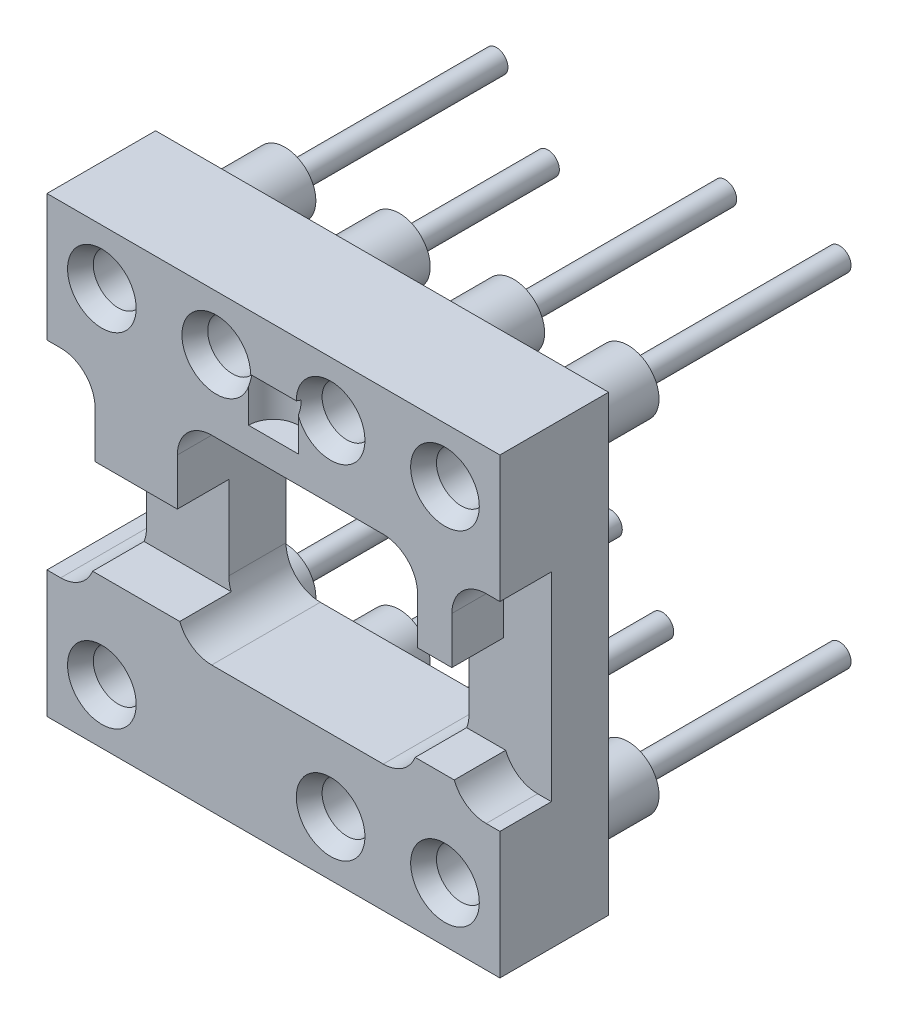
from build123d import *

# Parameters (mm, degrees)
ESQUISSE1_W             = 10.0584
ESQUISSE1_H             = 10.0584
BOSS_EXTRU_1_DEPTH      = 2.413
ESQUISSE2_W             = 5.334
ESQUISSE2_H             = 4.4196
ENL_V_MAT_EXTRU_1_DEPTH = 8.510544207
ESQUISSE3_W             = 1.143
ESQUISSE3_H             = 2.1336
ENL_V_MAT_EXTRU_2_DEPTH = 10.941918215
ESQUISSE4_W             = 1.0668
ESQUISSE4_H             = 1.8034
ENL_V_MAT_EXTRU_3_DEPTH = 1.143
ENL_V_MAT_EXTRU_4_DEPTH = 1.143
ESQUISSE6_W             = 1.0668
ESQUISSE6_H             = 4.4196
ENL_V_MAT_EXTRU_5_DEPTH = 8.510544207
ESQUISSE7_W             = 1.143
ESQUISSE7_H             = 2.1336
ENL_V_MAT_EXTRU_6_DEPTH = 10.078608125
PER_AGE1_D              = 1.1049
PER_AGE1_DEPTH          = 0.999998
PER_AGE2_D              = 1.1049
PER_AGE2_DEPTH          = 0.999998
PER_AGE3_D              = 1.1049
PER_AGE3_DEPTH          = 0.999998
ESQUISSE22_W            = 0.55245
ESQUISSE22_H            = 0.999998
PER_AGE5_D              = 1.1049
PER_AGE5_DEPTH          = 0.999998
PER_AGE6_D              = 1.1049
PER_AGE6_DEPTH          = 0.999998
PER_AGE7_D              = 1.1049
PER_AGE7_DEPTH          = 0.999998
PER_AGE8_D              = 1.1049
PER_AGE8_DEPTH          = 0.999998
CHANFREIN1_SIZE         = 0.20955
CHANFREIN1_SIZE2        = 0.362951247
CHANFREIN2_SIZE         = 0.20955
CHANFREIN2_SIZE2        = 0.362951247
CHANFREIN3_SIZE         = 0.20955
CHANFREIN3_SIZE2        = 0.362951247
CHANFREIN4_SIZE         = 0.20955
CHANFREIN4_SIZE2        = 0.362951247
CHANFREIN5_SIZE         = 0.20955
CHANFREIN5_SIZE_2       = 0.362951247
CHANFREIN6_SIZE         = 0.20955
CHANFREIN6_SIZE2        = 0.362951247
CHANFREIN7_SIZE         = 0.20955
CHANFREIN7_SIZE_2       = 0.362951247
CONG_1_R                = 0.762
CONG_2_R                = 0.762
CONG_3_R                = 0.762
CONG_4_R                = 0.762
CONG_5_R                = 0.762
CONG_6_R                = 0.762
CONG_7_R                = 0.762


with BuildPart() as part:
    # Esquisse1 → Boss.-Extru.1 (new body)
    with BuildSketch(Plane.XY):
        Rectangle(ESQUISSE1_W, ESQUISSE1_H)
    extrude(amount=-BOSS_EXTRU_1_DEPTH)

    # Esquisse2 → Enlèv. mat.-Extru.1 (cut, through all)
    with BuildSketch(Plane(origin=(0, 0, -2.413), x_dir=(-1, 0, 0), z_dir=(0, 0, -1))):
        with Locations((-0.5334, 0)):
            Rectangle(ESQUISSE2_W, ESQUISSE2_H)
    extrude(amount=-ENL_V_MAT_EXTRU_1_DEPTH, mode=Mode.SUBTRACT)

    # Esquisse3 → Enlèv. mat.-Extru.2 (cut, through all)
    with BuildSketch(Plane.ZY.offset(-3.2004)):
        with Locations((-0.5715, -0.6604)):
            Rectangle(ESQUISSE3_W, ESQUISSE3_H)
    extrude(amount=-ENL_V_MAT_EXTRU_2_DEPTH, mode=Mode.SUBTRACT)

    # Esquisse4 → Enlèv. mat.-Extru.3 (cut)
    with BuildSketch(Plane.XY):
        with Locations((4.4958, 1.3081)):
            Rectangle(ESQUISSE4_W, ESQUISSE4_H)
    extrude(amount=-ENL_V_MAT_EXTRU_3_DEPTH, mode=Mode.SUBTRACT)

    # Esquisse5 → Enlèv. mat.-Extru.4 (cut)
    with BuildSketch(Plane.XY):
        with BuildLine():
            Line((5.0292, -1.7272), (4.015471485, -1.7272))
            ThreePointArc((4.015471485, -1.7272), (4.295598647, -2.077699516), (4.7244, -2.2098))
            Line((4.7244, -2.2098), (5.0292, -2.2098))
            Line((5.0292, -2.2098), (5.0292, -1.7272))
        make_face()
    extrude(amount=-ENL_V_MAT_EXTRU_4_DEPTH, mode=Mode.SUBTRACT)

    # Esquisse6 → Enlèv. mat.-Extru.5 (cut, through all)
    with BuildSketch(Plane(origin=(0, 0, -2.413), x_dir=(-1, 0, 0), z_dir=(0, 0, -1))):
        with Locations((4.4958, 0)):
            Rectangle(ESQUISSE6_W, ESQUISSE6_H)
    extrude(amount=-ENL_V_MAT_EXTRU_5_DEPTH, mode=Mode.SUBTRACT)

    # Esquisse7 → Enlèv. mat.-Extru.6 (cut, through all)
    with BuildSketch(Plane(origin=(-2.1336, 0, 0), x_dir=(0, 0, -1), z_dir=(1, 0, 0))):
        with Locations((0.5715, -0.6604)):
            Rectangle(ESQUISSE7_W, ESQUISSE7_H)
    extrude(amount=-ENL_V_MAT_EXTRU_6_DEPTH, mode=Mode.SUBTRACT)

    # Esquisse8 → Révolution1 (revolve)
    with BuildSketch(Plane(origin=(0, -3.81, 0), x_dir=(-1, 0, 0), z_dir=(0, 1, 0))):
        Polygon((-4.064, -8.763), (-3.81, -8.763), (-3.81, -2.413), (-4.49834, -2.413), (-4.49834, -4.064), (-4.064, -4.318), align=None)
    revolve(axis=Axis((3.81, -3.81, -8.763), (0, 0, 1)))

    # Esquisse9 → Révolution2 (revolve)
    with BuildSketch(Plane(origin=(0, -3.81, 0), x_dir=(-1, 0, 0), z_dir=(0, 1, 0))):
        Polygon((-1.524, -7.366), (-1.27, -7.366), (-1.27, -2.413), (-1.95834, -2.413), (-1.95834, -4.064), (-1.524, -4.318), align=None)
    revolve(axis=Axis((1.27, -3.81, -7.366), (0, 0, 1)))

    # Esquisse10 → Révolution3 (revolve)
    with BuildSketch(Plane(origin=(0, -3.81, 0), x_dir=(-1, 0, 0), z_dir=(0, 1, 0))):
        Polygon((1.016, -8.763), (1.27, -8.763), (1.27, -2.413), (0.58166, -2.413), (0.58166, -4.064), (1.016, -4.318), align=None)
    revolve(axis=Axis((-1.27, -3.81, -8.763), (0, 0, 1)))

    # Esquisse11 → Révolution4 (revolve)
    with BuildSketch(Plane(origin=(0, -3.81, 0), x_dir=(-1, 0, 0), z_dir=(0, 1, 0))):
        Polygon((3.556, -8.763), (3.81, -8.763), (3.81, -2.413), (3.12166, -2.413), (3.12166, -4.064), (3.556, -4.318), align=None)
    revolve(axis=Axis((-3.81, -3.81, -8.763), (0, 0, 1)))

    # Esquisse12 → Révolution5 (revolve)
    with BuildSketch(Plane(origin=(0, 3.81, 0), x_dir=(-1, 0, 0), z_dir=(0, 1, 0))):
        Polygon((-4.064, -8.763), (-3.81, -8.763), (-3.81, -2.413), (-4.49834, -2.413), (-4.49834, -4.064), (-4.064, -4.318), align=None)
    revolve(axis=Axis((3.81, 3.81, -8.763), (0, 0, 1)))

    # Esquisse13 → Révolution6 (revolve)
    with BuildSketch(Plane(origin=(0, 3.81, 0), x_dir=(-1, 0, 0), z_dir=(0, 1, 0))):
        Polygon((-1.524, -8.763), (-1.27, -8.763), (-1.27, -2.413), (-1.95834, -2.413), (-1.95834, -4.064), (-1.524, -4.318), align=None)
    revolve(axis=Axis((1.27, 3.81, -8.763), (0, 0, 1)))

    # Esquisse14 → Révolution7 (revolve)
    with BuildSketch(Plane(origin=(0, 3.81, 0), x_dir=(-1, 0, 0), z_dir=(0, 1, 0))):
        Polygon((1.016, -7.366), (1.27, -7.366), (1.27, -2.413), (0.58166, -2.413), (0.58166, -4.064), (1.016, -4.318), align=None)
    revolve(axis=Axis((-1.27, 3.81, -7.366), (0, 0, 1)))

    # Esquisse15 → Révolution8 (revolve)
    with BuildSketch(Plane(origin=(0, 3.81, 0), x_dir=(-1, 0, 0), z_dir=(0, 1, 0))):
        Polygon((3.556, -8.763), (3.81, -8.763), (3.81, -2.413), (3.12166, -2.413), (3.12166, -4.064), (3.556, -4.318), align=None)
    revolve(axis=Axis((-3.81, 3.81, -8.763), (0, 0, 1)))

    # Perçage1
    with Locations(Plane.XY):
        with Locations((3.81, -3.81)):
            Hole(PER_AGE1_D / 2, depth=PER_AGE1_DEPTH)

    # Perçage2
    with Locations(Plane.XY):
        with Locations((-3.81, 3.81)):
            Hole(PER_AGE2_D / 2, depth=PER_AGE2_DEPTH)

    # Perçage3
    with Locations(Plane.XY):
        with Locations((1.27, -3.81)):
            Hole(PER_AGE3_D / 2, depth=PER_AGE3_DEPTH)

    # Esquisse22 → Perçage4 (revolve, cut)
    with BuildSketch(Plane(origin=(0, 3.81, 0), x_dir=(0, 0, 1), z_dir=(1, 0, 0))):
        with Locations((0.276225, 0.499999)):
            Rectangle(ESQUISSE22_W, ESQUISSE22_H)
    revolve(axis=Axis((0, -106.19, 0), (0, 1, 0)), mode=Mode.SUBTRACT)

    # Perçage5
    with Locations(Plane.XY):
        with Locations((-3.81, -3.81)):
            Hole(PER_AGE5_D / 2, depth=PER_AGE5_DEPTH)

    # Perçage6
    with Locations(Plane.XY):
        with Locations((1.27, 3.81)):
            Hole(PER_AGE6_D / 2, depth=PER_AGE6_DEPTH)

    # Perçage7
    with Locations(Plane.XY):
        with Locations((3.81, 3.81)):
            Hole(PER_AGE7_D / 2, depth=PER_AGE7_DEPTH)

    # Perçage8
    with Locations(Plane.XY):
        with Locations((-1.27, 3.81)):
            Hole(PER_AGE8_D / 2, depth=PER_AGE8_DEPTH)

    # Chanfrein1
    chanfrein1_edges = [part.edges().sort_by_distance(p)[0] for p in [
        (4.36245, -3.81, 0),
    ]]
    chanfrein1_side = [part.faces().sort_by_distance(p)[0] for p in [
        (-0.07802689, -3.515242334, 0),
    ]]
    chamfer(chanfrein1_edges, length=CHANFREIN1_SIZE, length2=CHANFREIN1_SIZE2, reference=chanfrein1_side[0])

    # Chanfrein2
    chanfrein2_edges = [part.edges().sort_by_distance(p)[0] for p in [
        (-3.25755, 3.81, 0),
    ]]
    chanfrein2_side = [part.faces().sort_by_distance(p)[0] for p in [
        (4.4958, 2.32049855, 0),
    ]]
    chamfer(chanfrein2_edges, length=CHANFREIN2_SIZE, length2=CHANFREIN2_SIZE2, reference=chanfrein2_side[0])

    # Chanfrein3
    chanfrein3_edges = [part.edges().sort_by_distance(p)[0] for p in [
        (1.82245, -3.81, 0),
    ]]
    chanfrein3_side = [part.faces().sort_by_distance(p)[0] for p in [
        (-0.207492952, -3.505427301, 0),
    ]]
    chamfer(chanfrein3_edges, length=CHANFREIN3_SIZE, length2=CHANFREIN3_SIZE2, reference=chanfrein3_side[0])

    # Chanfrein4
    chanfrein4_edges = [part.edges().sort_by_distance(p)[0] for p in [
        (-3.25755, -3.81, 0),
    ]]
    chanfrein4_side = [part.faces().sort_by_distance(p)[0] for p in [
        (-0.258386154, -3.494936097, 0),
    ]]
    chamfer(chanfrein4_edges, length=CHANFREIN4_SIZE, length2=CHANFREIN4_SIZE2, reference=chanfrein4_side[0])

    # Chanfrein5
    # the kernel refuses this chamfer: 0.362951247, 0.20955 mm, written as the material it takes off along each edge
    with BuildSketch(Plane(origin=(1.27, 3.81, 0), x_dir=(-1, 0, 0), z_dir=(0, -1, 0))) as chanfrein5_piece_1:
        Polygon((0.55245 + CHANFREIN5_SIZE, 0), (0.55245, CHANFREIN5_SIZE_2), (0.55245, 0), align=None)
    revolve(axis=Axis((1.27, 3.81, 0), (0, 0, -1)), mode=Mode.SUBTRACT)

    # Chanfrein6
    chanfrein6_edges = [part.edges().sort_by_distance(p)[0] for p in [
        (4.36245, 3.81, 0),
    ]]
    chanfrein6_side = [part.faces().sort_by_distance(p)[0] for p in [
        (4.4958, 2.32049855, 0),
    ]]
    chamfer(chanfrein6_edges, length=CHANFREIN6_SIZE, length2=CHANFREIN6_SIZE2, reference=chanfrein6_side[0])

    # Chanfrein7
    # the kernel refuses this chamfer: 0.362951247, 0.20955 mm, written as the material it takes off along each edge
    with BuildSketch(Plane(origin=(-1.27, 3.81, 0), x_dir=(-1, 0, 0), z_dir=(0, -1, 0))) as chanfrein7_piece_1:
        Polygon((0.55245 + CHANFREIN7_SIZE, 0), (0.55245, CHANFREIN7_SIZE_2), (0.55245, 0), align=None)
    revolve(axis=Axis((-1.27, 3.81, 0), (0, 0, -1)), mode=Mode.SUBTRACT)

    # Congé1
    cong_1_edges = [part.edges().sort_by_distance(p)[0] for p in [
        (-2.1336, -2.2098, -1.2065),
    ]]
    fillet(cong_1_edges, radius=CONG_1_R)

    # Congé2
    cong_2_edges = [part.edges().sort_by_distance(p)[0] for p in [
        (-3.9624, -2.2098, -1.2065),
    ]]
    fillet(cong_2_edges, radius=CONG_2_R)

    # Congé3
    cong_3_edges = [part.edges().sort_by_distance(p)[0] for p in [
        (-2.1336, 2.2098, -1.2065),
    ]]
    fillet(cong_3_edges, radius=CONG_3_R)

    # Congé4
    cong_4_edges = [part.edges().sort_by_distance(p)[0] for p in [
        (-3.9624, 2.2098, -1.2065),
    ]]
    fillet(cong_4_edges, radius=CONG_4_R)

    # Congé5
    cong_5_edges = [part.edges().sort_by_distance(p)[0] for p in [
        (3.2004, -2.2098, -1.2065),
    ]]
    fillet(cong_5_edges, radius=CONG_5_R)

    # Congé6
    cong_6_edges = [part.edges().sort_by_distance(p)[0] for p in [
        (3.9624, 2.2098, -0.5715),
    ]]
    fillet(cong_6_edges, radius=CONG_6_R)

    # Congé7
    cong_7_edges = [part.edges().sort_by_distance(p)[0] for p in [
        (3.2004, 2.2098, -1.2065),
    ]]
    fillet(cong_7_edges, radius=CONG_7_R)


solid = part.part
